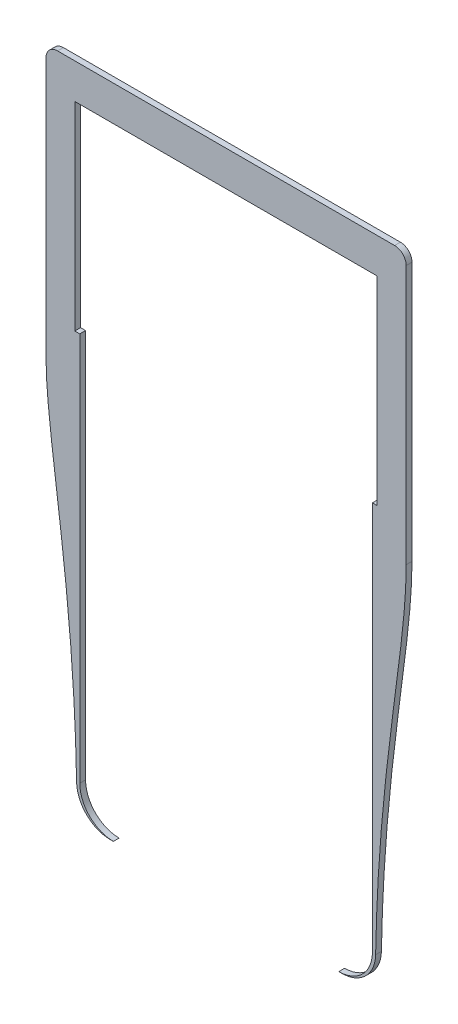
from build123d import *

# Parameters (mm, degrees)
BOSS_EXTRUDE1_START = -1.5
BOSS_EXTRUDE1_DEPTH = 1.5
CUT_EXTRUDE1_DEPTH  = 14
FILLET1_R           = 8.7
FILLET2_R           = 3


# Read off the part's stored shape, not the designer's step: Boss-Extrude1
with BuildPart() as part:
    # Boss-Extrude1 outline → Boss-Extrude1 (new body)
    with BuildSketch(Plane.XY.offset(BOSS_EXTRUDE1_START)):
        with BuildLine():
            Line((101.710048323, 103.170955585), (101.710048323, 33.070955585))
            add(Edge.make_bspline(
                [(101.710048323, 33.070955585), (101.710048323, 14.099715191), (109.710048323, -16.929044415), (109.710048323, -66.929044415)],
                knots=[0, 0, 0, 0, 1, 1, 1, 1], degree=3))
            Line((109.710048323, -66.929044415), (187.010048323, -66.929044415))
            add(Edge.make_bspline(
                [(195.010048323, 33.070955585), (195.010048323, 11.335097122), (187.010048323, -16.929044415), (187.010048323, -66.929044415)],
                knots=[0, 0, 0, 0, 1, 1, 1, 1], degree=3))
            Line((195.010048323, 33.070955585), (195.010048323, 103.170955585))
            Line((195.010048323, 103.170955585), (101.710048323, 103.170955585))
        make_face()
    extrude(amount=BOSS_EXTRUDE1_DEPTH)

    # Sketch2 → Cut-Extrude1 (cut)
    with BuildSketch(Plane.XY):
        with BuildLine():
            Line((109.160048323, 94.070955585), (187.460048323, 94.070955585))
            Line((187.460048323, 94.070955585), (187.460048323, 42.570955585))
            Line((187.460048323, 42.570955585), (186.260048323, 42.570955585))
            Line((186.260048323, 42.570955585), (186.260048323, -58.229044415))
            ThreePointArc((186.260048323, -58.229044415), (183.711877319, -64.380873411), (177.560048323, -66.929044415))
            Line((177.560048323, -66.929044415), (119.160048323, -66.929044415))
            ThreePointArc((119.160048323, -66.929044415), (113.008219327, -64.380873411), (110.460048323, -58.229044415))
            Line((110.460048323, -58.229044415), (110.460048323, 42.570955585))
            Line((110.460048323, 42.570955585), (109.160048323, 42.570955585))
            Line((109.160048323, 42.570955585), (109.160048323, 94.070955585))
        make_face()
    extrude(amount=-CUT_EXTRUDE1_DEPTH, mode=Mode.SUBTRACT)

    # Fillet1
    fillet1_edges = [part.edges().sort_by_distance(p)[0] for p in [
        (187.010048323, -66.929044415, -0.75),
        (109.710048323, -66.929044415, -0.75),
    ]]
    fillet(fillet1_edges, radius=FILLET1_R)

    # Fillet2
    fillet2_edges = [part.edges().sort_by_distance(p)[0] for p in [
        (101.710048323, 103.170955585, -0.75),
        (195.010048323, 103.170955585, -0.75),
    ]]
    fillet(fillet2_edges, radius=FILLET2_R)


solid = part.part
